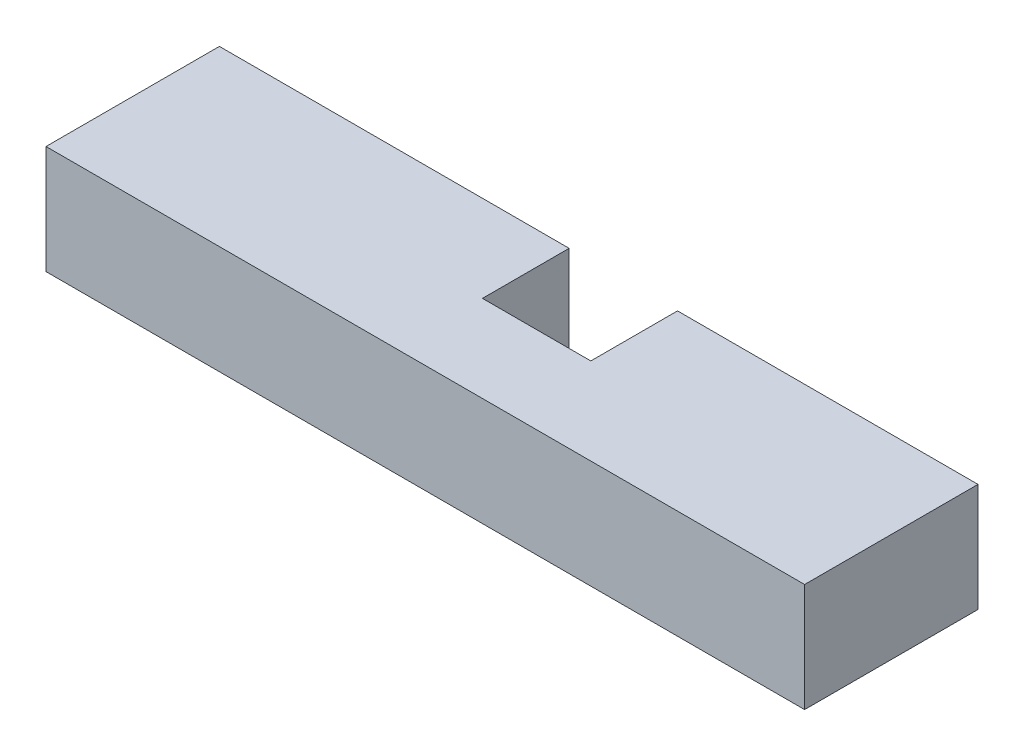
from build123d import *

# Parameters (mm, degrees)
BOSS_EXTRUDE1_DEPTH = 6.35


with BuildPart() as part:
    # Elevator Paddle Support Strut → Boss-Extrude1 (new body)
    with BuildSketch(Plane(origin=(0, 0, 0), x_dir=(1, 0, 0), z_dir=(0, 1, 0))):
        Polygon((-22.225, 5.08), (-22.225, -5.08), (22.225, -5.08), (22.225, 5.08), (4.617903309, 5.08), (4.617903309, 0), (-1.732096691, 0), (-1.732096691, 5.08), align=None)
    extrude(amount=BOSS_EXTRUDE1_DEPTH)


solid = part.part
